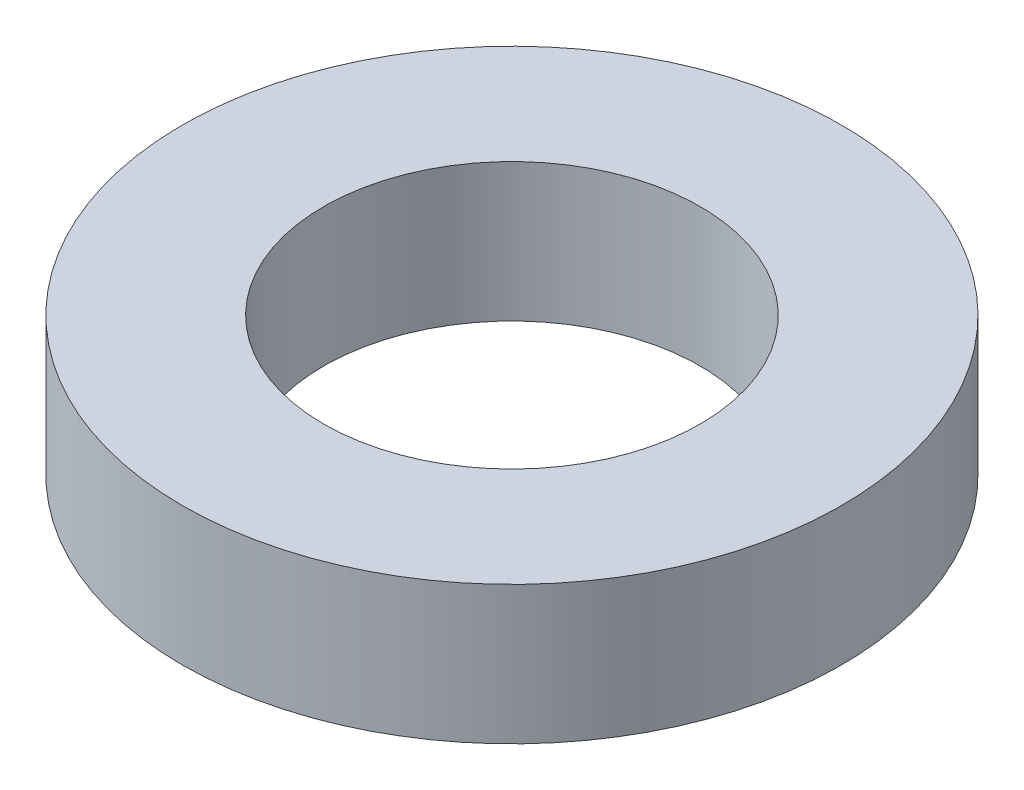
from build123d import *

# Parameters (mm, degrees)
SKETCH1_R           = 52.5
BOSS_EXTRUDE1_DEPTH = 22
SKETCH2_R           = 30
CUT_EXTRUDE1_DEPTH  = 78.437071226


with BuildPart() as part:
    # Sketch1 → Boss-Extrude1 (new body)
    with BuildSketch(Plane(origin=(0, 0, 0), x_dir=(1, 0, 0), z_dir=(0, 1, 0))):
        Circle(SKETCH1_R)
    extrude(amount=BOSS_EXTRUDE1_DEPTH)

    # Sketch2 → Cut-Extrude1 (cut, through all)
    with BuildSketch(Plane(origin=(0, 0, 0), x_dir=(1, 0, 0), z_dir=(0, 1, 0))):
        Circle(SKETCH2_R)
    extrude(amount=CUT_EXTRUDE1_DEPTH, mode=Mode.SUBTRACT)


solid = part.part
